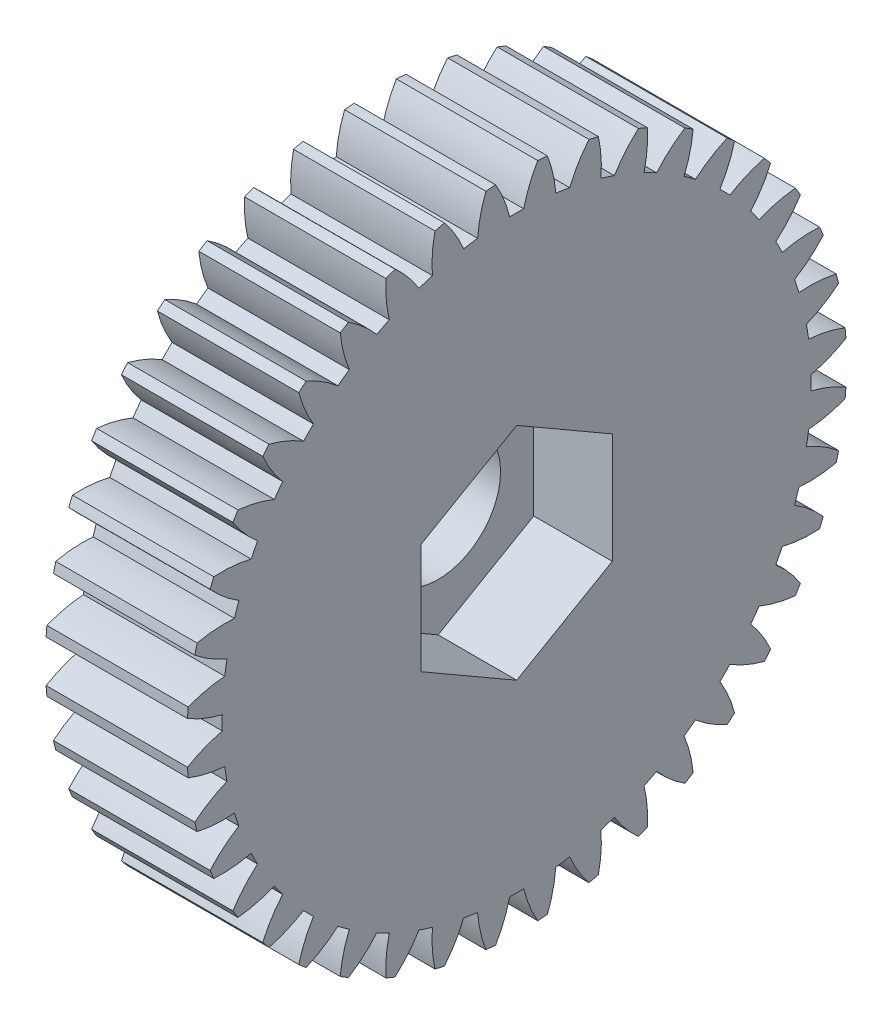
from build123d import *

# Parameters (mm, degrees)
BASPROSKE_W         = 9
BASPROSKE_H         = 21
TOOTHCUT_DEPTH      = 32.032241298
TEETHCUTS_COUNT     = 40
TEETHCUTS_ANGLE     = 351
BORSKE_R            = 2
BORE_DEPTH          = 50.0000508
CUT_EXTRUDE1_DEPTH  = 5
SKETCH1_7_R         = 3.9725
CUT_EXTRUDE2_DEPTH  = 31.974304622
SKETCH2_R           = 6
SKETCH2_R_2         = 4
BOSS_EXTRUDE1_DEPTH = 1.3


with BuildPart() as part:
    # BasProSke → Base-Revolve (revolve)
    with BuildSketch(Plane(origin=(0, 0, 0), x_dir=(1, 0, 0), z_dir=(0, 1, 0))):
        with Locations((4.5, 10.5)):
            Rectangle(BASPROSKE_W, BASPROSKE_H)
    revolve(axis=Axis((-10, 0, 0), (1, 0, 0)))

    # TooCutSke → ToothCut (cut, through all)
    with BuildSketch(Plane(origin=(0, 0, 0), x_dir=(0, 0, -1), z_dir=(1, 0, 0))):
        with BuildLine():
            ThreePointArc((0.448673268, 18.74363074), (0, 18.749), (-0.448673268, 18.74363074))
            ThreePointArc((-0.448673268, 18.74363074), (-0.816786816, 19.89705013), (-1.354745081, 20.981708961))
            ThreePointArc((-1.354745081, 20.981708961), (0, 21.0254), (1.354745081, 20.981708961))
            ThreePointArc((1.354745081, 20.981708961), (0.816786816, 19.89705013), (0.448673268, 18.74363074))
        make_face()
    toothcut = extrude(amount=TOOTHCUT_DEPTH, mode=Mode.SUBTRACT)

    # TeethCuts: ToothCut ×40 about axis
    teethcuts_axis = Axis((-10, 0, 0), (1, 0, 0))
    for i in range(1, TEETHCUTS_COUNT):
        add(toothcut.rotate(teethcuts_axis, i * TEETHCUTS_ANGLE / (TEETHCUTS_COUNT - 1)), mode=Mode.SUBTRACT)

    # BorSke → Bore (cut, symmetric)
    with BuildSketch(Plane(origin=(0, 0, 0), x_dir=(0, 0, -1), z_dir=(1, 0, 0))):
        Circle(BORSKE_R)
    extrude(amount=BORE_DEPTH, both=True, mode=Mode.SUBTRACT)

    # Sketch1 → Cut-Extrude1 (cut)
    with BuildSketch(Plane(origin=(9, 0, 0), x_dir=(0, 0, -1), z_dir=(1, 0, 0))):
        Polygon((0, 7.025), (-6.083828462, 3.5125), (-6.083828462, -3.5125), (0, -7.025), (6.083828462, -3.5125), (6.083828462, 3.5125), align=None)
    extrude(amount=-CUT_EXTRUDE1_DEPTH, mode=Mode.SUBTRACT)

    # Sketch1<7> → Cut-Extrude2 (cut, through all)
    with BuildSketch(Plane(origin=(9, 0, 0), x_dir=(0, 0, -1), z_dir=(1, 0, 0))):
        Circle(SKETCH1_7_R)
    extrude(amount=-CUT_EXTRUDE2_DEPTH, mode=Mode.SUBTRACT)

    # Sketch2 → Boss-Extrude1 (add)
    with BuildSketch(Plane.ZY):
        Circle(SKETCH2_R)
        Circle(SKETCH2_R_2, mode=Mode.SUBTRACT)
    extrude(amount=BOSS_EXTRUDE1_DEPTH)


solid = part.part
